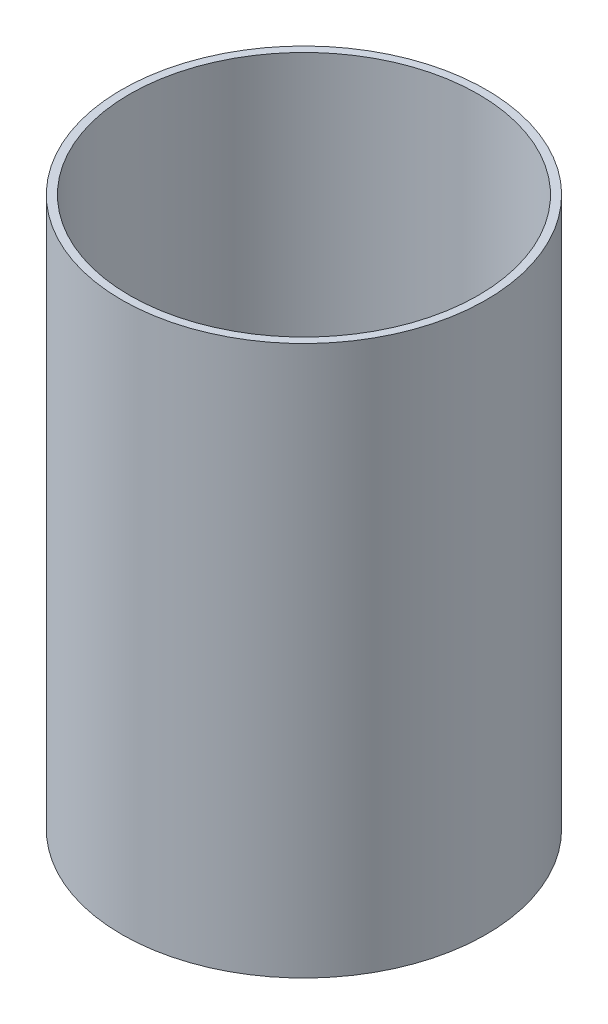
from build123d import *
from build123d.topology import SkipClean

# Parameters (mm, degrees)
SKETCH1_R                = 117.602
SKETCH1_R_2              = 112.522
BOSS_EXTRUDE1_DEPTH      = 354.6856
SKETCH2_R                = 117.602
SKETCH2_R_2              = 58.460386
BOSS_EXTRUDE2_DEPTH      = 5.08
BOSS_EXTRUDE3_REACH      = 443.535
BOSS_EXTRUDE3_END_RADIUS = 117.602
SKETCH3_R                = 25.4
BOSS_EXTRUDE4_START      = 12.7
SKETCH4_R                = 25.4
BOSS_EXTRUDE4_DEPTH      = 12.7
CUT_EXTRUDE1_REACH       = 450.429
SKETCH5_R                = 21.59


with BuildPart() as part:
    # Sketch1 → Boss-Extrude1 (new body)
    with BuildSketch(Plane(origin=(0, 0, 0), x_dir=(1, 0, 0), z_dir=(0, 1, 0))):
        Circle(SKETCH1_R)
        Circle(SKETCH1_R_2, mode=Mode.SUBTRACT)
    extrude(amount=BOSS_EXTRUDE1_DEPTH)

    # Sketch2 → Boss-Extrude2 (add)
    with BuildSketch(Plane.XZ):
        Circle(SKETCH2_R)
        Circle(SKETCH2_R_2, mode=Mode.SUBTRACT)
    extrude(amount=-BOSS_EXTRUDE2_DEPTH)

    # Boss-Extrude3: up to this cylinder (the profile starts outside it)
    with SkipClean():  # the faces are left unmerged after this step: merging them gives an invalid solid
        boss_extrude3_end = Plane(origin=(0, 36.564295, 0), z_dir=(0, -1, 0)) * Cylinder(BOSS_EXTRUDE3_END_RADIUS, 1123.274, mode=Mode.PRIVATE)
        # Sketch3 → Boss-Extrude3 (add, up to the surface)
        with BuildSketch(Plane.ZY.offset(117.602), mode=Mode.PRIVATE) as boss_extrude3_sk1:
            with Locations((0, 36.564295185)):
                Circle(SKETCH3_R)
        boss_extrude3_tool1 = extrude(boss_extrude3_sk1.sketch, amount=-BOSS_EXTRUDE3_REACH, mode=Mode.PRIVATE) - boss_extrude3_end
        add(boss_extrude3_tool1.solids().sort_by_distance((-117.602, 36.564295, 0))[0])
        add(boss_extrude3_tool1.solids().sort_by_distance((-117.602, 36.564295, 0))[1])

    # Sketch4 → Boss-Extrude4 (add)
    with BuildSketch(Plane.ZY.offset(117.602).offset(BOSS_EXTRUDE4_START)):
        with Locations((0, 36.564295185)):
            Circle(SKETCH4_R)
    extrude(amount=-BOSS_EXTRUDE4_DEPTH)

    # Sketch5 → Cut-Extrude1 (cut, up to next)
    with BuildSketch(Plane.ZY.offset(130.302), mode=Mode.PRIVATE) as cut_extrude1_sk1:
        with Locations((0, 36.564295185)):
            Circle(SKETCH5_R)
    cut_extrude1_tool1 = extrude(cut_extrude1_sk1.sketch, amount=-CUT_EXTRUDE1_REACH, mode=Mode.PRIVATE) & part.part
    add(cut_extrude1_tool1.solids().sort_by_distance((-130.302, 36.564295, 0))[0], mode=Mode.SUBTRACT)


solid = part.part
